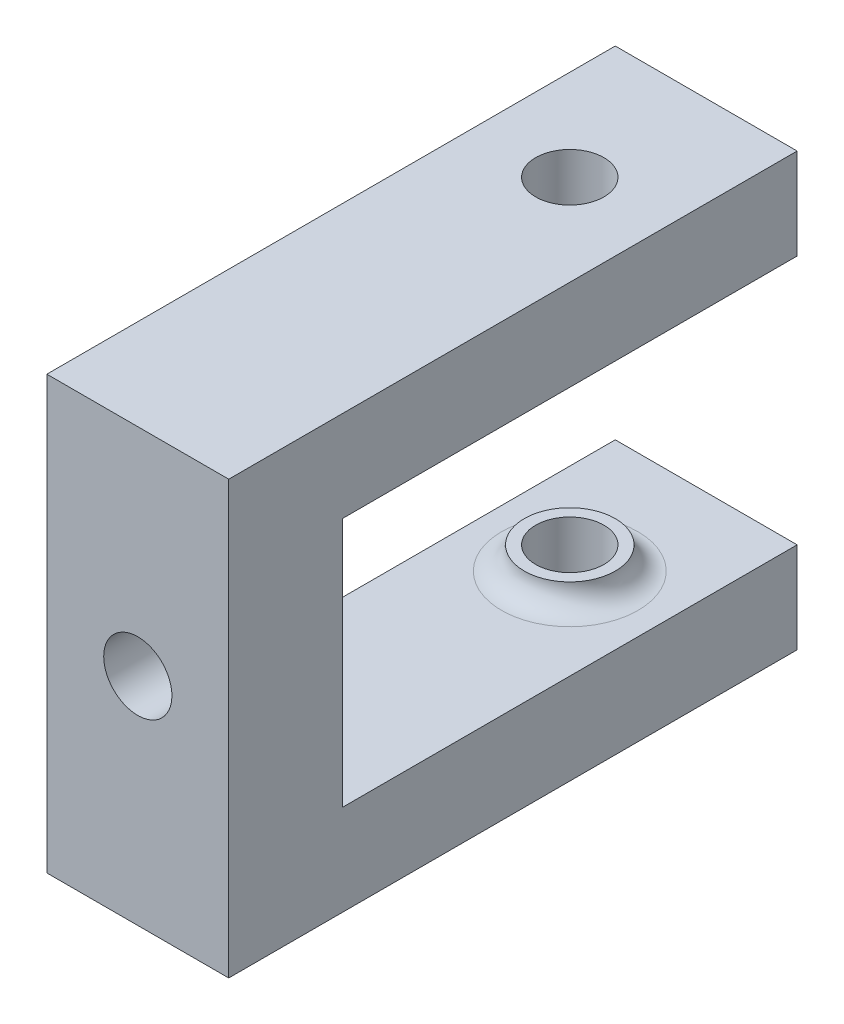
from build123d import *

# Parameters (mm, degrees)
EXTRUDE_1_DEPTH     = 8
CUT_EXTRUDE_1_REACH = 34.404
SKETCH_4_R          = 1.5
EXTRUDE_START       = 1
SKETCH_5_R          = 2
SKETCH_5_R_2        = 1.5
EXTRUDE_2_DEPTH     = 1
SKETCH_6_R          = 2
SKETCH_6_R_2        = 1.5
EXTRUDE_3_DEPTH     = 1
FILLET_1_R          = 1
FILLET_2_R          = 1
SKETCH_7_R          = 1.5
CUT_EXTRUDE_2_DEPTH = 5
CUT_EXTRUDE_3_DEPTH = 2


with BuildPart() as part:
    # Эскиз3 → Бобышка-Вытянуть1 (new body)
    with BuildSketch(Plane(origin=(0, 0, 0), x_dir=(0, 0, -1), z_dir=(1, 0, 0))):
        Polygon((0, 0), (25, 0), (25, 4), (5, 4), (5, 15), (25, 15), (25, 19), (0, 19), align=None)
    extrude(amount=EXTRUDE_1_DEPTH)

    # Вырез-Вытянуть1: up to this face of the body (flat: up to its plane)
    cut_extrude_1_end = Plane(part.part.faces().sort_by_distance((4, 0, -12.5))[0])
    # Эскиз4 → Вырез-Вытянуть1 (cut, up to the picked face)
    with BuildSketch(Plane(origin=(0, 19, 0), x_dir=(1, 0, 0), z_dir=(0, 1, 0)), mode=Mode.PRIVATE) as cut_extrude_1_sk1:
        with Locations(Location((4, 19, 0), (0, 0, 270))):
            Circle(SKETCH_4_R)
    cut_extrude_1_tool1 = split(extrude(cut_extrude_1_sk1.sketch, amount=-CUT_EXTRUDE_1_REACH, mode=Mode.PRIVATE), bisect_by=cut_extrude_1_end, keep=Keep.BOTH, mode=Mode.PRIVATE)
    add(cut_extrude_1_tool1.solids().sort_by(Axis((4, 19, -19), (0, -1, 0)))[0], mode=Mode.SUBTRACT)

    # Эскиз5 → Бобышка-Вытянуть2 (add)
    with BuildSketch(Plane(origin=(0, 4, 0), x_dir=(1, 0, 0), z_dir=(0, 1, 0)).offset(EXTRUDE_START)):
        with Locations(Location((4, 19, 0), (0, 0, 90))):
            Circle(SKETCH_5_R)
        with Locations(Location((4, 19, 0), (0, 0, 270))):
            Circle(SKETCH_5_R_2, mode=Mode.SUBTRACT)
    extrude(amount=-EXTRUDE_2_DEPTH)

    # Эскиз6 → Бобышка-Вытянуть3 (add)
    with BuildSketch(Plane(origin=(0, 15, 0), x_dir=(-1, 0, 0), z_dir=(0, -1, 0))):
        with Locations(Location((-4, 19, 0), (0, 0, 90))):
            Circle(SKETCH_6_R)
        with Locations(Location((-4, 19, 0), (0, 0, 270))):
            Circle(SKETCH_6_R_2, mode=Mode.SUBTRACT)
    extrude(amount=EXTRUDE_3_DEPTH)

    # Скругление1
    fillet_1_edges = [part.edges().sort_by_distance(p)[0] for p in [
        (4, 4, -17),
    ]]
    fillet(fillet_1_edges, radius=FILLET_1_R - 0.0001)  # a hair under: the kernel refuses the full size

    # Скругление2
    fillet_2_edges = [part.edges().sort_by_distance(p)[0] for p in [
        (4, 15, -17),
    ]]
    fillet(fillet_2_edges, radius=FILLET_2_R - 0.0001)  # a hair under: the kernel refuses the full size

    # Эскиз7 → Вырез-Вытянуть2 (cut)
    with BuildSketch(Plane(origin=(0, 0, -5), x_dir=(-1, 0, 0), z_dir=(0, 0, -1))):
        with Locations((-4, 9.5)):
            Circle(SKETCH_7_R)
    extrude(amount=-CUT_EXTRUDE_2_DEPTH, mode=Mode.SUBTRACT)

    # Эскиз9 → Вырез-Вытянуть3 (cut)
    with BuildSketch(Plane(origin=(0, 0, -5), x_dir=(-1, 0, 0), z_dir=(0, 0, -1))):
        Polygon((-1.264118223, 11.111919426), (-4.028022284, 12.675302834), (-6.763904061, 11.063383407), (-6.735881777, 7.888080574), (-3.971977716, 6.324697166), (-1.236095939, 7.936616593), align=None)
    extrude(amount=-CUT_EXTRUDE_3_DEPTH, mode=Mode.SUBTRACT)


solid = part.part
